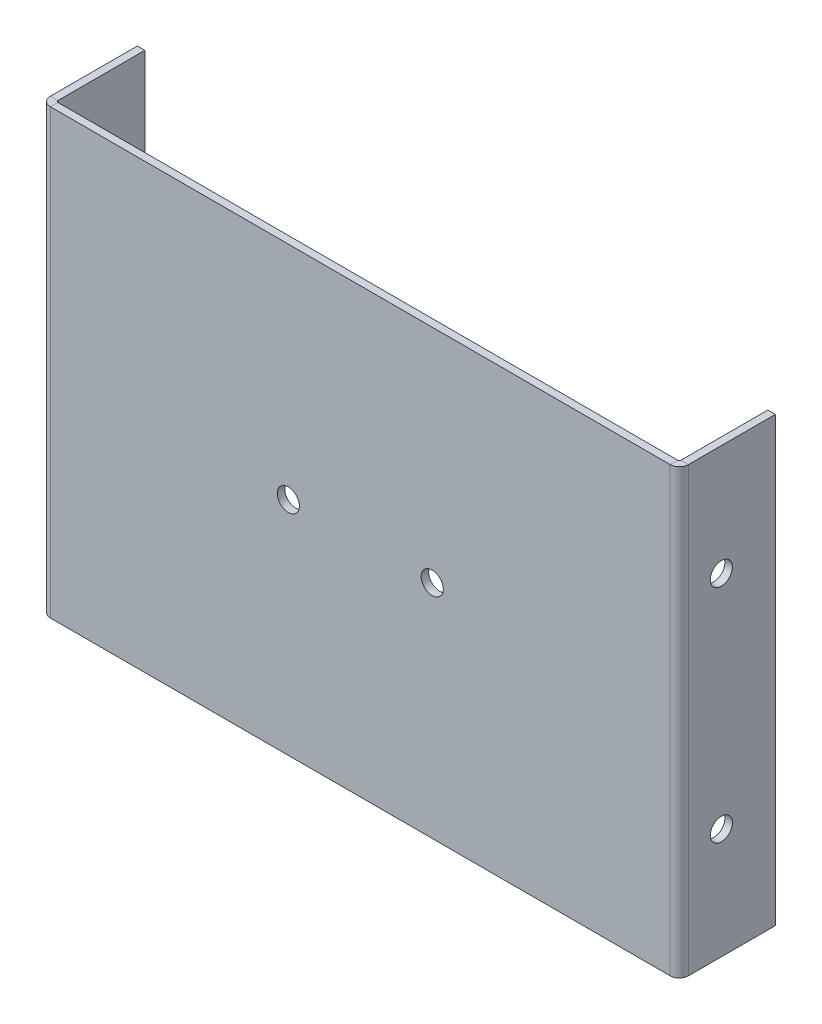
from build123d import *

# Parameters (mm, degrees)
SKETCH1_W                    = 288.2
SKETCH1_H                    = 200
SKETCH1_R                    = 5
BASE_FLANGE1_DEPTH           = 3.4
EDGE_FLANGE2_STRIP_W         = 15.0732
EDGE_FLANGE2_STRIP_H         = 3.4
EDGE_FLANGE2_STRIP_CUT_DEPTH = 200
EDGE_FLANGE2_DEPTH           = 200
EDGE_FLANGE2_PROFILE_W       = 200
EDGE_FLANGE2_PROFILE_H       = 39.2634
EDGE_FLANGE2_PROFILE_R       = 5
EDGE_FLANGE2_FLAT_DEPTH      = 3.4
EDGE_FLANGE3_STRIP_W         = 15.0732
EDGE_FLANGE3_STRIP_H         = 3.4
EDGE_FLANGE3_STRIP_CUT_DEPTH = 200
EDGE_FLANGE3_DEPTH           = 200
EDGE_FLANGE3_PROFILE_W       = 200
EDGE_FLANGE3_PROFILE_H       = 39.2634
EDGE_FLANGE3_PROFILE_R       = 5
EDGE_FLANGE3_FLAT_DEPTH      = 3.4


# Sheet-metal steps are written as plain solids
with BuildPart() as part:
    # Sketch1 → Base-Flange1 (new body)
    with BuildSketch(Plane.XY):
        with Locations((-144.1, -100)):
            Rectangle(SKETCH1_W, SKETCH1_H)
        with Locations((-111.6, -100)):
            Circle(SKETCH1_R, mode=Mode.SUBTRACT)
        with Locations(Location((-176.6, -100, 0), (0, 0, 180))):
            Circle(SKETCH1_R, mode=Mode.SUBTRACT)
    extrude(amount=-BASE_FLANGE1_DEPTH)

    # Edge-Flange2 strip (across the edge) → Edge-Flange2 strip cut (cut)
    with BuildSketch(Plane(origin=(0, 0, -3.4), x_dir=(-1, 0, 0), z_dir=(0, -1, 0))):
        with Locations((-3.4, -1.7)):
            Rectangle(EDGE_FLANGE2_STRIP_W, EDGE_FLANGE2_STRIP_H)
    extrude(amount=EDGE_FLANGE2_STRIP_CUT_DEPTH, mode=Mode.SUBTRACT)

    # Edge-Flange2 bend section (across the edge) → Edge-Flange2 (add)
    with BuildSketch(Plane(origin=(0, 0, -3.4), x_dir=(-1, 0, 0), z_dir=(0, -1, 0))):
        with BuildLine():
            Line((0, 0.7366), (3.4, 0.7366))
            ThreePointArc((3.4, 0.7366), (3.615745145, 0.215745145), (4.1366, 0))
            Line((4.1366, 0), (4.1366, -3.4))
            ThreePointArc((4.1366, -3.4), (1.211582089, -2.188417911), (0, 0.7366))
        make_face()
    extrude(amount=EDGE_FLANGE2_DEPTH)

    # Edge-Flange2 profile (on flange) → Edge-Flange2 flat (add)
    with BuildSketch(Plane(origin=(0, 0, -3.4), x_dir=(0, -1, 0), z_dir=(1, 0, 0))):
        with Locations((100, 20.3683)):
            Rectangle(EDGE_FLANGE2_PROFILE_W, EDGE_FLANGE2_PROFILE_H)
        with Locations((150, 15.6)):
            Circle(EDGE_FLANGE2_PROFILE_R, mode=Mode.SUBTRACT)
        with Locations((50, 15.6)):
            Circle(EDGE_FLANGE2_PROFILE_R, mode=Mode.SUBTRACT)
    extrude(amount=-EDGE_FLANGE2_FLAT_DEPTH)

    # Edge-Flange3 strip (across the edge) → Edge-Flange3 strip cut (cut)
    with BuildSketch(Plane(origin=(-288.2, -200, -3.4), x_dir=(1, 0, 0), z_dir=(0, 1, 0))):
        with Locations((-3.4, -1.7)):
            Rectangle(EDGE_FLANGE3_STRIP_W, EDGE_FLANGE3_STRIP_H)
    extrude(amount=EDGE_FLANGE3_STRIP_CUT_DEPTH, mode=Mode.SUBTRACT)

    # Edge-Flange3 bend section (across the edge) → Edge-Flange3 (add)
    with BuildSketch(Plane(origin=(-288.2, -200, -3.4), x_dir=(1, 0, 0), z_dir=(0, 1, 0))):
        with BuildLine():
            Line((0, 0.7366), (3.4, 0.7366))
            ThreePointArc((3.4, 0.7366), (3.615745145, 0.215745145), (4.1366, 0))
            Line((4.1366, 0), (4.1366, -3.4))
            ThreePointArc((4.1366, -3.4), (1.211582089, -2.188417911), (0, 0.7366))
        make_face()
    extrude(amount=EDGE_FLANGE3_DEPTH)

    # Edge-Flange3 profile (on flange) → Edge-Flange3 flat (add)
    with BuildSketch(Plane(origin=(-288.2, 0, -3.4), x_dir=(0, 1, 0), z_dir=(-1, 0, 0))):
        with Locations((-100, 20.3683)):
            Rectangle(EDGE_FLANGE3_PROFILE_W, EDGE_FLANGE3_PROFILE_H)
        with Locations((-50, 15.6)):
            Circle(EDGE_FLANGE3_PROFILE_R, mode=Mode.SUBTRACT)
        with Locations((-150, 15.6)):
            Circle(EDGE_FLANGE3_PROFILE_R, mode=Mode.SUBTRACT)
    extrude(amount=-EDGE_FLANGE3_FLAT_DEPTH)


solid = part.part
